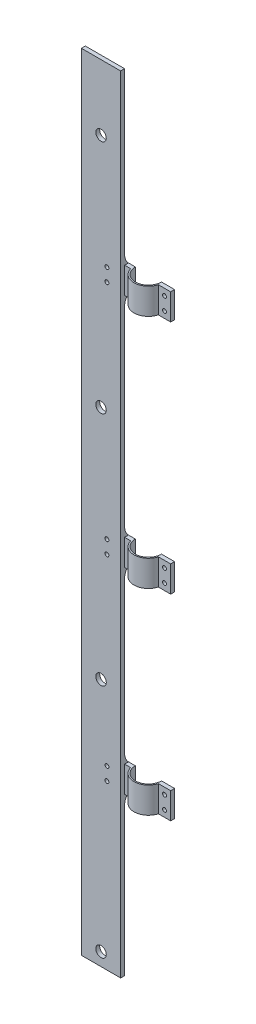
from build123d import *

# Parameters (mm, degrees)
SKETCH_1_W          = 30
SKETCH_1_H          = 300
SKETCH_1_R          = 4
EXTRUDE_1_DEPTH     = 3
EXTRUDE_2_DEPTH     = 10
EXTRUDE_3_DEPTH     = 10
EXTRUDE_4_DEPTH     = 10
SKETCH_13_R         = 1.5
CUT_EXTRUDE_1_DEPTH = 20
FILLET_1_R          = 10


with BuildPart() as part:
    # 草图1 → 凸台-拉伸1 (new body)
    # profile 1 of 2: a face of its own
    with BuildSketch(Plane.XY):
        with Locations((-15, 150)):
            Rectangle(SKETCH_1_W, SKETCH_1_H)
        with Locations((-15, 69.99339056)):
            Circle(SKETCH_1_R, mode=Mode.SUBTRACT)
        with Locations((-15, 249.99339056)):
            Circle(SKETCH_1_R, mode=Mode.SUBTRACT)
    # profile 2 of 2: a face of its own
    with BuildSketch(Plane.XY):
        with Locations((-15, -150)):
            Rectangle(SKETCH_1_W, SKETCH_1_H)
        with Locations((-15, -290.00660944)):
            Circle(SKETCH_1_R, mode=Mode.SUBTRACT)
        with Locations((-15, -110.00660944)):
            Circle(SKETCH_1_R, mode=Mode.SUBTRACT)
    extrude(amount=EXTRUDE_1_DEPTH)

    # 草图10 → 凸台-拉伸2 (add, symmetric)
    with BuildSketch(Plane(origin=(0, -20.00660944, 0), x_dir=(1, 0, 0), z_dir=(0, 1, 0))):
        with BuildLine():
            Line((-30, 0), (4.616994756, 0))
            ThreePointArc((4.616994756, 0), (15.2, -8), (25.783005244, 0))
            Line((25.783005244, 0), (35.2, 0))
            Line((35.2, 0), (35.2, 3))
            Line((35.2, 3), (25.2, 3))
            ThreePointArc((25.2, 3), (15.2, -7), (5.2, 3))
            Line((5.2, 3), (-30, 3))
            Line((-30, 3), (-30, 0))
        make_face()
    extrude(amount=EXTRUDE_2_DEPTH, both=True)

    # 草图11 → 凸台-拉伸3 (add, symmetric)
    with BuildSketch(Plane(origin=(0, 159.99339056, 0), x_dir=(1, 0, 0), z_dir=(0, 1, 0))):
        with BuildLine():
            Line((-30, 0), (4.616994756, 0))
            ThreePointArc((4.616994756, 0), (15.2, -8), (25.783005244, 0))
            Line((25.783005244, 0), (35.2, 0))
            Line((35.2, 0), (35.2, 3))
            Line((35.2, 3), (25.2, 3))
            ThreePointArc((25.2, 3), (15.2, -7), (5.2, 3))
            Line((5.2, 3), (-30, 3))
            Line((-30, 3), (-30, 0))
        make_face()
    extrude(amount=EXTRUDE_3_DEPTH, both=True)

    # 草图12 → 凸台-拉伸4 (add, symmetric)
    with BuildSketch(Plane(origin=(0, -170.00660944, 0), x_dir=(1, 0, 0), z_dir=(0, 1, 0))):
        with BuildLine():
            Line((-30, 0), (4.616994756, 0))
            ThreePointArc((4.616994756, 0), (15.2, -8), (25.783005244, 0))
            Line((25.783005244, 0), (35.2, 0))
            Line((35.2, 0), (35.2, 3))
            Line((35.2, 3), (25.2, 3))
            ThreePointArc((25.2, 3), (15.2, -7), (5.2, 3))
            Line((5.2, 3), (-30, 3))
            Line((-30, 3), (-30, 0))
        make_face()
    extrude(amount=EXTRUDE_4_DEPTH, both=True)

    # 草图13 → 切除-拉伸1 (cut)
    with BuildSketch(Plane.XY.offset(3)):
        with Locations((30.491502622, 164.99339056)):
            Circle(SKETCH_13_R)
        with Locations((30.491502622, 154.99339056)):
            Circle(SKETCH_13_R)
        with Locations((-10.5, 154.99339056)):
            Circle(SKETCH_13_R)
        with Locations((-10.5, 164.99339056)):
            Circle(SKETCH_13_R)
        with Locations((30.491502622, -15.00660944)):
            Circle(SKETCH_13_R)
        with Locations((30.491502622, -25.00660944)):
            Circle(SKETCH_13_R)
        with Locations((-10.5, -25.00660944)):
            Circle(SKETCH_13_R)
        with Locations((-10.5, -15.00660944)):
            Circle(SKETCH_13_R)
        with Locations((30.491502622, -165.00660944)):
            Circle(SKETCH_13_R)
        with Locations((30.491502622, -175.00660944)):
            Circle(SKETCH_13_R)
        with Locations((-10.5, -175.00660944)):
            Circle(SKETCH_13_R)
        with Locations((-10.5, -165.00660944)):
            Circle(SKETCH_13_R)
    extrude(amount=-CUT_EXTRUDE_1_DEPTH, mode=Mode.SUBTRACT)

    # 圆角1
    # the kernel refuses this fillet: 10 mm, written as the material it adds along each edge
    with BuildSketch(Plane(origin=(-30, -160.00660944, 0), x_dir=(0, 1, 0), z_dir=(1, 0, 0)), Plane(origin=(-30, -10.00660944, 0), x_dir=(0, 1, 0), z_dir=(1, 0, 0)), Plane(origin=(-30, 169.99339056, 0), x_dir=(0, 1, 0), z_dir=(1, 0, 0))) as fillet_1_piece_1:
        with BuildLine():
            CenterArc((7.141428429, -10), FILLET_1_R, 90, 45.572995999)
            Line((0, -3), (0, 0))
            Line((0, 0), (7.141428429, 0))
        make_face()
    extrude(amount=30)
    with BuildSketch(Plane(origin=(-30, -180.00660944, 0), x_dir=(0, -1, 0), z_dir=(1, 0, 0)), Plane(origin=(-30, -30.00660944, 0), x_dir=(0, -1, 0), z_dir=(1, 0, 0)), Plane(origin=(-30, 149.99339056, 0), x_dir=(0, -1, 0), z_dir=(1, 0, 0))) as fillet_1_piece_2:
        with BuildLine():
            CenterArc((7.141428429, 10), FILLET_1_R, 224.427004001, 45.572995999)
            Line((0, 3), (0, 0))
            Line((0, 0), (7.141428429, 0))
        make_face()
    extrude(amount=30)


solid = part.part
